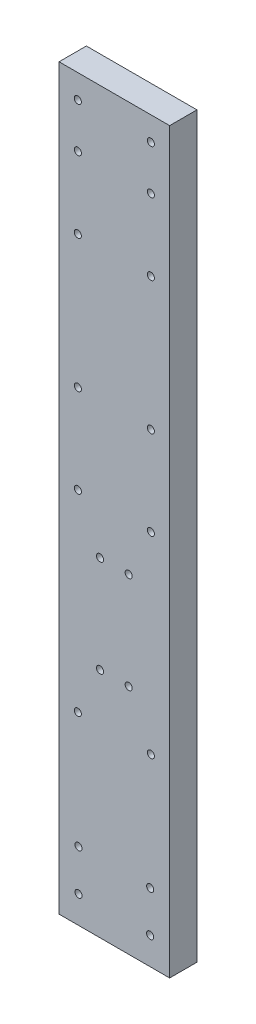
from build123d import *

# Parameters (mm, degrees)
SKETCH1_W           = 16.2
SKETCH1_H           = 108.14
SKETCH1_R           = 0.519960121
BOSS_EXTRUDE1_DEPTH = 4


with BuildPart() as part:
    # Sketch1 → Boss-Extrude1 (new body)
    with BuildSketch(Plane.XY):
        with Locations((8.1, 54.07)):
            Rectangle(SKETCH1_W, SKETCH1_H)
        with Locations((13.45, 55.21)):
            Circle(SKETCH1_R, mode=Mode.SUBTRACT)
        with Locations((10.2, 48.21)):
            Circle(SKETCH1_R, mode=Mode.SUBTRACT)
        with Locations((13.45, 104.66)):
            Circle(SKETCH1_R, mode=Mode.SUBTRACT)
        with Locations((2.75, 98.16)):
            Circle(SKETCH1_R, mode=Mode.SUBTRACT)
        with Locations((6, 48.21)):
            Circle(SKETCH1_R, mode=Mode.SUBTRACT)
        with Locations((2.75, 27)):
            Circle(SKETCH1_R, mode=Mode.SUBTRACT)
        with Locations((2.75, 87.66)):
            Circle(SKETCH1_R, mode=Mode.SUBTRACT)
        with Locations((2.75, 55.21)):
            Circle(SKETCH1_R, mode=Mode.SUBTRACT)
        with Locations((13.45, 87.66)):
            Circle(SKETCH1_R, mode=Mode.SUBTRACT)
        with Locations((13.45, 98.16)):
            Circle(SKETCH1_R, mode=Mode.SUBTRACT)
        with Locations((13.45, 68.21)):
            Circle(SKETCH1_R, mode=Mode.SUBTRACT)
        with Locations((6, 34)):
            Circle(SKETCH1_R, mode=Mode.SUBTRACT)
        with Locations((2.75, 104.66)):
            Circle(SKETCH1_R, mode=Mode.SUBTRACT)
        with Locations((10.2, 34)):
            Circle(SKETCH1_R, mode=Mode.SUBTRACT)
        with Locations((2.75, 68.21)):
            Circle(SKETCH1_R, mode=Mode.SUBTRACT)
        with Locations((13.45, 27)):
            Circle(SKETCH1_R, mode=Mode.SUBTRACT)
        with Locations((2.85, 10)):
            Circle(SKETCH1_R, mode=Mode.SUBTRACT)
        with Locations((13.35, 10)):
            Circle(SKETCH1_R, mode=Mode.SUBTRACT)
        with Locations((13.35, 4)):
            Circle(SKETCH1_R, mode=Mode.SUBTRACT)
        with Locations((2.85, 4)):
            Circle(SKETCH1_R, mode=Mode.SUBTRACT)
    extrude(amount=BOSS_EXTRUDE1_DEPTH)


solid = part.part
